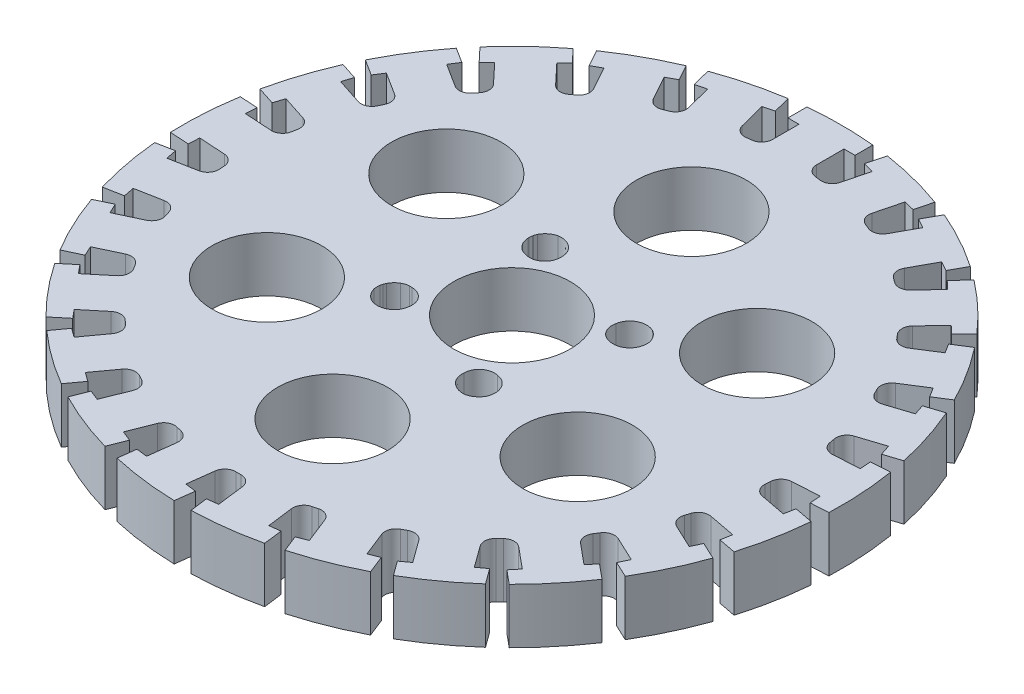
from build123d import *

# Parameters (mm, degrees)
BOSS_EXTRUDE2_DEPTH      = 6.35
FILLET2_R                = 1.27
FILLET3_R                = 1.27
CUT_EXTRUDE1_REACH       = 56.254
SKETCH2_R                = 2.413
SKETCH2_R_2              = 6.35
CUT_EXTRUDE4_START       = -6.35
CUT_EXTRUDE4_OUTLINE_R   = 6.75
CUT_EXTRUDE4_OUTLINE_R_2 = 2.413
CUT_EXTRUDE4_DEPTH       = 6.35


# Read off the part's stored shape, not the designer's step: Cut-Extrude4
with BuildPart() as part:
    # Sketch1 → Boss-Extrude2 (new body)
    with BuildSketch(Plane(origin=(0, 0, 0), x_dir=(1, 0, 0), z_dir=(0, 1, 0))):
        with BuildLine():
            Line((-2.54, 31.528459964), (-2.54, 35.718625011))
            Line((-2.54, 35.718625011), (-3.81, 35.718625011))
            Line((-3.81, 35.718625011), (-3.81, 37.909021354))
            ThreePointArc((-3.81, 37.909021354), (0, 38.1), (3.81, 37.909021354))
            Line((3.81, 37.909021354), (3.81, 35.847599361))
            Line((3.81, 35.847599361), (2.54, 35.847599361))
            Line((2.54, 35.847599361), (2.54, 31.528459964))
            ThreePointArc((2.54, 31.528459964), (3.96436643, 31.381191604), (5.380607922, 31.169607731))
            Line((5.380607922, 31.169607731), (6.422659594, 35.228131037))
            Line((6.422659594, 35.228131037), (5.19255898, 35.543967194))
            Line((5.19255898, 35.543967194), (5.737288399, 37.665548208))
            ThreePointArc((5.737288399, 37.665548208), (9.475084701, 36.903018439), (13.117892087, 35.770531268))
            Line((13.117892087, 35.770531268), (12.605237284, 33.773872638))
            Line((12.605237284, 33.773872638), (11.375136669, 34.089708794))
            Line((11.375136669, 34.089708794), (10.30101038, 29.906263104))
            ThreePointArc((10.30101038, 29.906263104), (11.644003568, 29.409395924), (12.963132459, 28.85225441))
            Line((12.963132459, 28.85225441), (14.981759865, 32.524124031))
            Line((14.981759865, 32.524124031), (13.868850382, 33.135951197))
            Line((13.868850382, 33.135951197), (14.924081868, 35.055410145))
            ThreePointArc((14.924081868, 35.055410145), (18.354814983, 33.38728451), (21.60153877, 31.384447148))
            Line((21.60153877, 31.384447148), (20.608441151, 29.578009285))
            Line((20.608441151, 29.578009285), (19.495531667, 30.189836451))
            Line((19.495531667, 30.189836451), (17.414770394, 26.404945745))
            ThreePointArc((17.414770394, 26.404945745), (18.592005138, 25.589699737), (19.731135709, 24.722007834))
            Line((19.731135709, 24.722007834), (22.599501065, 27.776506696))
            Line((22.599501065, 27.776506696), (21.673710908, 28.645881521))
            Line((21.673710908, 28.645881521), (23.173140386, 30.242611737))
            ThreePointArc((23.173140386, 30.242611737), (26.081244736, 27.773704705), (28.727881327, 25.02636279))
            Line((28.727881327, 25.02636279), (27.316740867, 23.523650829))
            Line((27.316740867, 23.523650829), (26.390950711, 24.393025653))
            Line((26.390950711, 24.393025653), (23.434296336, 21.244508535))
            ThreePointArc((23.434296336, 21.244508535), (24.371802648, 20.162108604), (25.259359136, 19.038386584))
            Line((25.259359136, 19.038386584), (28.797232498, 21.283589291))
            Line((28.797232498, 21.283589291), (28.116732468, 22.355885757))
            Line((28.116732468, 22.355885757), (29.966145269, 23.529558809))
            ThreePointArc((29.966145269, 23.529558809), (32.168893962, 20.415000889), (34.049145446, 17.095780017))
            Line((34.049145446, 17.095780017), (32.308629291, 15.991214877))
            Line((32.308629291, 15.991214877), (31.628129262, 17.063511342))
            Line((31.628129262, 17.063511342), (27.981359255, 14.749200722))
            ThreePointArc((27.981359255, 14.749200722), (28.620230165, 13.467658036), (29.200444132, 12.158513487))
            Line((29.200444132, 12.158513487), (33.185527904, 13.453345695))
            Line((33.185527904, 13.453345695), (32.793076321, 14.661187471))
            Line((32.793076321, 14.661187471), (34.876267036, 15.338057166))
            ThreePointArc((34.876267036, 15.338057166), (36.235253271, 11.773547486), (37.230976533, 8.091006511))
            Line((37.230976533, 8.091006511), (35.270447714, 7.453992083))
            Line((35.270447714, 7.453992083), (34.877996131, 8.661833859))
            Line((34.877996131, 8.661833859), (30.770250463, 7.327146384))
            ThreePointArc((30.770250463, 7.327146384), (31.070343363, 5.926984983), (31.30675783, 4.514676271))
            Line((31.30675783, 4.514676271), (35.488654544, 4.777778911))
            Line((35.488654544, 4.777778911), (35.408910584, 6.045272857))
            Line((35.408910584, 6.045272857), (37.59498468, 6.182808981))
            ThreePointArc((37.59498468, 6.182808981), (38.024818353, 2.392318794), (38.073448439, -1.42215469))
            Line((38.073448439, -1.42215469), (36.016094192, -1.551592448))
            Line((36.016094192, -1.551592448), (35.936350232, -0.284098502))
            Line((35.936350232, -0.284098502), (31.62573367, -0.555299509))
            ThreePointArc((31.62573367, -0.555299509), (31.568192619, -1.986102334), (31.445952797, -3.412834658))
            Line((31.445952797, -3.412834658), (35.5618985, -4.197993293))
            Line((35.5618985, -4.197993293), (35.79987277, -2.950488484))
            Line((35.79987277, -2.950488484), (37.951471172, -3.360927831))
            ThreePointArc((37.951471172, -3.360927831), (37.425144253, -7.139228086), (36.523625555, -10.845956681))
            Line((36.523625555, -10.845956681), (34.498717013, -10.459684718))
            Line((34.498717013, -10.459684718), (34.736691282, -9.21217991))
            Line((34.736691282, -9.21217991), (30.494055718, -8.402853892))
            ThreePointArc((30.494055718, -8.402853892), (30.082496232, -9.774395538), (29.609282898, -11.125904634))
            Line((29.609282898, -11.125904634), (33.400657587, -12.909990139))
            Line((33.400657587, -12.909990139), (33.941397287, -11.760859783))
            Line((33.941397287, -11.760859783), (35.923327154, -12.693485186))
            ThreePointArc((35.923327154, -12.693485186), (34.473910699, -16.222191009), (32.678888953, -19.588267326))
            Line((32.678888953, -19.588267326), (30.813658567, -18.71055653))
            Line((30.813658567, -18.71055653), (31.354398267, -17.561426173))
            Line((31.354398267, -17.561426173), (27.446324097, -15.722426061))
            ThreePointArc((27.446324097, -15.722426061), (26.706605972, -16.948527522), (25.91215286, -18.139893104))
            Line((25.91215286, -18.139893104), (29.140730518, -20.810804826))
            Line((29.140730518, -20.810804826), (29.950258985, -19.832253008))
            Line((29.950258985, -19.832253008), (31.637988375, -21.228464184))
            ThreePointArc((31.637988375, -21.228464184), (29.35655455, -24.285854009), (26.780817573, -27.099775094))
            Line((26.780817573, -27.099775094), (25.192464628, -25.785775262))
            Line((25.192464628, -25.785775262), (26.001993095, -24.807223444))
            Line((26.001993095, -24.807223444), (22.674038992, -22.054100377))
            ThreePointArc((22.674038992, -22.054100377), (21.652641438, -23.057721189), (20.58686696, -24.014085376))
            Line((20.58686696, -24.014085376), (23.049784179, -27.404000108))
            Line((23.049784179, -27.404000108), (24.077235762, -26.657512838))
            Line((24.077235762, -26.657512838), (25.364718429, -28.429580704))
            ThreePointArc((25.364718429, -28.429580704), (22.394618112, -30.823547486), (19.200008932, -32.908504327))
            Line((19.200008932, -32.908504327), (17.988335486, -31.240778902))
            Line((17.988335486, -31.240778902), (19.015787069, -30.494291631))
            Line((19.015787069, -30.494291631), (16.477060628, -27.000034458))
            ThreePointArc((16.477060628, -27.000034458), (15.23816181, -27.718113434), (13.968032495, -28.379384347))
            Line((13.968032495, -28.379384347), (15.510535129, -32.275301279))
            Line((15.510535129, -32.275301279), (16.691351266, -31.807783097))
            Line((16.691351266, -31.807783097), (17.49768994, -33.844362112))
            ThreePointArc((17.49768994, -33.844362112), (14.025545457, -35.424484112), (10.412793117, -36.649471203))
            Line((10.412793117, -36.649471203), (9.653933068, -34.732809507))
            Line((9.653933068, -34.732809507), (10.834749205, -34.265291325))
            Line((10.834749205, -34.265291325), (9.244767947, -30.249457074))
            ThreePointArc((9.244767947, -30.249457074), (7.866212434, -30.636874671), (6.471535178, -30.961502227))
            Line((6.471535178, -30.961502227), (6.996702112, -35.11862657))
            Line((6.996702112, -35.11862657), (8.256687783, -34.959453364))
            Line((8.256687783, -34.959453364), (8.53121724, -37.132577778))
            ThreePointArc((8.53121724, -37.132577778), (4.775196199, -37.79957012), (0.971303216, -38.087617017))
            Line((0.971303216, -38.087617017), (0.712938531, -36.042449953))
            Line((0.712938531, -36.042449953), (1.972924202, -35.883276746))
            Line((1.972924202, -35.883276746), (1.431592495, -31.598195053))
            ThreePointArc((1.431592495, -31.598195053), (0, -31.630608399), (-1.431592495, -31.598195053))
            Line((-1.431592495, -31.598195053), (-1.95675943, -35.755319397))
            Line((-1.95675943, -35.755319397), (-0.696773759, -35.914492604))
            Line((-0.696773759, -35.914492604), (-0.971303216, -38.087617017))
            ThreePointArc((-0.971303216, -38.087617017), (-4.775196199, -37.79957012), (-8.53121724, -37.132577778))
            Line((-8.53121724, -37.132577778), (-8.272852555, -35.087410713))
            Line((-8.272852555, -35.087410713), (-7.012866885, -35.246583919))
            Line((-7.012866885, -35.246583919), (-6.471535178, -30.961502227))
            ThreePointArc((-6.471535178, -30.961502227), (-7.866212434, -30.636874671), (-9.244767947, -30.249457074))
            Line((-9.244767947, -30.249457074), (-10.78727058, -34.145374007))
            Line((-10.78727058, -34.145374007), (-9.606454443, -34.612892189))
            Line((-9.606454443, -34.612892189), (-10.412793117, -36.649471203))
            ThreePointArc((-10.412793117, -36.649471203), (-14.025545457, -35.424484112), (-17.49768994, -33.844362112))
            Line((-17.49768994, -33.844362112), (-16.738829891, -31.927700416))
            Line((-16.738829891, -31.927700416), (-15.558013754, -32.395218597))
            Line((-15.558013754, -32.395218597), (-13.968032495, -28.379384347))
            ThreePointArc((-13.968032495, -28.379384347), (-15.23816181, -27.718113434), (-16.477060628, -27.000034458))
            Line((-16.477060628, -27.000034458), (-18.939977848, -30.38994919))
            Line((-18.939977848, -30.38994919), (-17.912526265, -31.13643646))
            Line((-17.912526265, -31.13643646), (-19.200008932, -32.908504327))
            ThreePointArc((-19.200008932, -32.908504327), (-22.394618112, -30.823547486), (-25.364718429, -28.429580704))
            Line((-25.364718429, -28.429580704), (-24.153044983, -26.761855279))
            Line((-24.153044983, -26.761855279), (-23.1255934, -27.50834255))
            Line((-23.1255934, -27.50834255), (-20.58686696, -24.014085376))
            ThreePointArc((-20.58686696, -24.014085376), (-21.652641438, -23.057721189), (-22.674038992, -22.054100377))
            Line((-22.674038992, -22.054100377), (-25.90261665, -24.725012099))
            Line((-25.90261665, -24.725012099), (-25.093088183, -25.703563918))
            Line((-25.093088183, -25.703563918), (-26.780817573, -27.099775094))
            ThreePointArc((-26.780817573, -27.099775094), (-29.35655455, -24.285854009), (-31.637988375, -21.228464184))
            Line((-31.637988375, -21.228464184), (-30.04963543, -19.914464353))
            Line((-30.04963543, -19.914464353), (-29.240106963, -20.893016171))
            Line((-29.240106963, -20.893016171), (-25.91215286, -18.139893104))
            ThreePointArc((-25.91215286, -18.139893104), (-26.706605972, -16.948527522), (-27.446324097, -15.722426061))
            Line((-27.446324097, -15.722426061), (-31.237698786, -17.506511566))
            Line((-31.237698786, -17.506511566), (-30.696959086, -18.655641923))
            Line((-30.696959086, -18.655641923), (-32.678888953, -19.588267326))
            ThreePointArc((-32.678888953, -19.588267326), (-34.473910699, -16.222191009), (-35.923327154, -12.693485186))
            Line((-35.923327154, -12.693485186), (-34.058096769, -11.81577439))
            Line((-34.058096769, -11.81577439), (-33.517357068, -12.964904747))
            Line((-33.517357068, -12.964904747), (-29.609282898, -11.125904634))
            ThreePointArc((-29.609282898, -11.125904634), (-30.082496232, -9.774395538), (-30.494055718, -8.402853892))
            Line((-30.494055718, -8.402853892), (-34.610001422, -9.188012527))
            Line((-34.610001422, -9.188012527), (-34.372027153, -10.435517335))
            Line((-34.372027153, -10.435517335), (-36.523625555, -10.845956681))
            ThreePointArc((-36.523625555, -10.845956681), (-37.425144253, -7.139228086), (-37.951471172, -3.360927831))
            Line((-37.951471172, -3.360927831), (-35.92656263, -2.974655868))
            Line((-35.92656263, -2.974655868), (-35.68858836, -4.222160676))
            Line((-35.68858836, -4.222160676), (-31.445952797, -3.412834658))
            ThreePointArc((-31.445952797, -3.412834658), (-31.568192619, -1.986102334), (-31.62573367, -0.555299509))
            Line((-31.62573367, -0.555299509), (-35.807630383, -0.292196869))
            Line((-35.807630383, -0.292196869), (-35.887374343, -1.559690814))
            Line((-35.887374343, -1.559690814), (-38.073448439, -1.42215469))
            ThreePointArc((-38.073448439, -1.42215469), (-38.024818353, 2.392318794), (-37.59498468, 6.182808981))
            Line((-37.59498468, 6.182808981), (-35.537630433, 6.053371223))
            Line((-35.537630433, 6.053371223), (-35.617374393, 4.785877278))
            Line((-35.617374393, 4.785877278), (-31.30675783, 4.514676271))
            ThreePointArc((-31.30675783, 4.514676271), (-31.070343363, 5.926984983), (-30.770250463, 7.327146384))
            Line((-30.770250463, 7.327146384), (-34.755334235, 8.621978593))
            Line((-34.755334235, 8.621978593), (-35.147785818, 7.414136817))
            Line((-35.147785818, 7.414136817), (-37.230976533, 8.091006511))
            ThreePointArc((-37.230976533, 8.091006511), (-36.235253271, 11.773547486), (-34.876267036, 15.338057166))
            Line((-34.876267036, 15.338057166), (-32.915738217, 14.701042737))
            Line((-32.915738217, 14.701042737), (-33.3081898, 13.493200961))
            Line((-33.3081898, 13.493200961), (-29.200444132, 12.158513487))
            ThreePointArc((-29.200444132, 12.158513487), (-28.620230165, 13.467658036), (-27.981359255, 14.749200722))
            Line((-27.981359255, 14.749200722), (-31.519232616, 16.99440343))
            Line((-31.519232616, 16.99440343), (-32.199732646, 15.922106964))
            Line((-32.199732646, 15.922106964), (-34.049145446, 17.095780017))
            ThreePointArc((-34.049145446, 17.095780017), (-32.168893962, 20.415000889), (-29.966145269, 23.529558809))
            Line((-29.966145269, 23.529558809), (-28.225629114, 22.424993669))
            Line((-28.225629114, 22.424993669), (-28.906129143, 21.352697204))
            Line((-28.906129143, 21.352697204), (-25.259359136, 19.038386584))
            ThreePointArc((-25.259359136, 19.038386584), (-24.371802648, 20.162108604), (-23.434296336, 21.244508535))
            Line((-23.434296336, 21.244508535), (-26.302661692, 24.299007398))
            Line((-26.302661692, 24.299007398), (-27.228451849, 23.429632574))
            Line((-27.228451849, 23.429632574), (-28.727881327, 25.02636279))
            ThreePointArc((-28.727881327, 25.02636279), (-26.081244736, 27.773704705), (-23.173140386, 30.242611737))
            Line((-23.173140386, 30.242611737), (-21.761999926, 28.739899776))
            Line((-21.761999926, 28.739899776), (-22.687790083, 27.870524951))
            Line((-22.687790083, 27.870524951), (-19.731135709, 24.722007834))
            ThreePointArc((-19.731135709, 24.722007834), (-18.592005138, 25.589699737), (-17.414770394, 26.404945745))
            Line((-17.414770394, 26.404945745), (-19.4333978, 30.076815367))
            Line((-19.4333978, 30.076815367), (-20.546307284, 29.4649882))
            Line((-20.546307284, 29.4649882), (-21.60153877, 31.384447148))
            ThreePointArc((-21.60153877, 31.384447148), (-18.354814983, 33.38728451), (-14.924081868, 35.055410145))
            Line((-14.924081868, 35.055410145), (-13.930984249, 33.248972282))
            Line((-13.930984249, 33.248972282), (-15.043893733, 32.637145116))
            Line((-15.043893733, 32.637145116), (-12.963132459, 28.85225441))
            ThreePointArc((-12.963132459, 28.85225441), (-11.644003568, 29.409395924), (-10.30101038, 29.906263104))
            Line((-10.30101038, 29.906263104), (-11.343062053, 33.964786411))
            Line((-11.343062053, 33.964786411), (-12.573162667, 33.648950254))
            Line((-12.573162667, 33.648950254), (-13.117892087, 35.770531268))
            ThreePointArc((-13.117892087, 35.770531268), (-9.475084701, 36.903018439), (-5.737288399, 37.665548208))
            Line((-5.737288399, 37.665548208), (-5.224633596, 35.668889578))
            Line((-5.224633596, 35.668889578), (-6.454734211, 35.353053421))
            Line((-6.454734211, 35.353053421), (-5.380607922, 31.169607731))
            ThreePointArc((-5.380607922, 31.169607731), (-3.96436643, 31.381191604), (-2.54, 31.528459964))
        make_face()
    extrude(amount=BOSS_EXTRUDE2_DEPTH)

    # Fillet2
    fillet2_edges = [part.edges().sort_by_distance(p)[0] for p in [
        (-2.54, 3.175, -31.528459964),
        (2.54, 3.175, -31.528459964),
        (5.380607922, 3.175, -31.169607731),
        (10.30101038, 3.175, -29.906263104),
        (12.963132459, 3.175, -28.85225441),
        (17.414770394, 3.175, -26.404945745),
        (19.731135709, 3.175, -24.722007834),
        (23.434296336, 3.175, -21.244508535),
        (25.259359136, 3.175, -19.038386584),
        (27.981359255, 3.175, -14.749200722),
        (29.200444132, 3.175, -12.158513487),
        (30.770250463, 3.175, -7.327146384),
        (31.30675783, 3.175, -4.514676271),
        (31.62573367, 3.175, 0.555299509),
        (31.445952797, 3.175, 3.412834658),
        (30.494055718, 3.175, 8.402853892),
        (29.609282898, 3.175, 11.125904634),
        (27.446324097, 3.175, 15.722426061),
        (25.91215286, 3.175, 18.139893104),
        (22.674038992, 3.175, 22.054100377),
        (20.58686696, 3.175, 24.014085376),
        (16.477060628, 3.175, 27.000034458),
        (13.968032495, 3.175, 28.379384347),
        (9.244767947, 3.175, 30.249457074),
        (6.471535178, 3.175, 30.961502227),
        (1.431592495, 3.175, 31.598195053),
        (-1.431592495, 3.175, 31.598195053),
        (-6.471535178, 3.175, 30.961502227),
        (-9.244767947, 3.175, 30.249457074),
        (-13.968032495, 3.175, 28.379384347),
        (-16.477060628, 3.175, 27.000034458),
        (-20.58686696, 3.175, 24.014085376),
        (-22.674038992, 3.175, 22.054100377),
        (-25.91215286, 3.175, 18.139893104),
        (-27.446324097, 3.175, 15.722426061),
        (-30.494055718, 3.175, 8.402853892),
        (-31.62573367, 3.175, 0.555299509),
        (-30.770250463, 3.175, -7.327146384),
        (-29.200444132, 3.175, -12.158513487),
        (-27.981359255, 3.175, -14.749200722),
        (-25.259359136, 3.175, -19.038386584),
        (-23.434296336, 3.175, -21.244508535),
        (-19.731135709, 3.175, -24.722007834),
        (-17.414770394, 3.175, -26.404945745),
        (-12.963132459, 3.175, -28.85225441),
        (-10.30101038, 3.175, -29.906263104),
        (-5.380607922, 3.175, -31.169607731),
    ]]
    fillet(fillet2_edges, radius=FILLET2_R)

    # Fillet3
    fillet3_edges = [part.edges().sort_by_distance(p)[0] for p in [
        (-29.609282898, 3.175, 11.125904634),
        (-31.445952797, 3.175, 3.412834658),
        (-31.30675783, 3.175, -4.514676271),
    ]]
    fillet(fillet3_edges, radius=FILLET3_R)

    # Sketch2 → Cut-Extrude1 (cut, up to next)
    with BuildSketch(Plane(origin=(0, 6.35, 0), x_dir=(1, 0, 0), z_dir=(0, 1, 0)), mode=Mode.PRIVATE) as cut_extrude1_sk1:
        with Locations(Location((0, 0, 0), (0, 0, 270))):
            Circle(SKETCH2_R)
    cut_extrude1_tool1 = extrude(cut_extrude1_sk1.sketch, amount=-CUT_EXTRUDE1_REACH, mode=Mode.PRIVATE) & part.part
    # Sketch2 → Cut-Extrude1 (cut, up to next)
    with BuildSketch(Plane(origin=(0, 6.35, 0), x_dir=(1, 0, 0), z_dir=(0, 1, 0)), mode=Mode.PRIVATE) as cut_extrude1_sk2:
        with Locations(Location((0, 20.747039709, 0), (0, 0, 270))):
            Circle(SKETCH2_R_2)
    cut_extrude1_tool2 = extrude(cut_extrude1_sk2.sketch, amount=-CUT_EXTRUDE1_REACH, mode=Mode.PRIVATE) & part.part
    # Sketch2 → Cut-Extrude1 (cut, up to next)
    with BuildSketch(Plane(origin=(0, 6.35, 0), x_dir=(1, 0, 0), z_dir=(0, 1, 0)), mode=Mode.PRIVATE) as cut_extrude1_sk3:
        with Locations(Location((17.967463441, 10.373519854, 0), (0, 0, 270))):
            Circle(SKETCH2_R_2)
    cut_extrude1_tool3 = extrude(cut_extrude1_sk3.sketch, amount=-CUT_EXTRUDE1_REACH, mode=Mode.PRIVATE) & part.part
    # Sketch2 → Cut-Extrude1 (cut, up to next)
    with BuildSketch(Plane(origin=(0, 6.35, 0), x_dir=(1, 0, 0), z_dir=(0, 1, 0)), mode=Mode.PRIVATE) as cut_extrude1_sk4:
        with Locations(Location((17.967463441, -10.373519854, 0), (0, 0, 270))):
            Circle(SKETCH2_R_2)
    cut_extrude1_tool4 = extrude(cut_extrude1_sk4.sketch, amount=-CUT_EXTRUDE1_REACH, mode=Mode.PRIVATE) & part.part
    # Sketch2 → Cut-Extrude1 (cut, up to next)
    with BuildSketch(Plane(origin=(0, 6.35, 0), x_dir=(1, 0, 0), z_dir=(0, 1, 0)), mode=Mode.PRIVATE) as cut_extrude1_sk5:
        with Locations(Location((0, -20.747039709, 0), (0, 0, 270))):
            Circle(SKETCH2_R_2)
    cut_extrude1_tool5 = extrude(cut_extrude1_sk5.sketch, amount=-CUT_EXTRUDE1_REACH, mode=Mode.PRIVATE) & part.part
    # Sketch2 → Cut-Extrude1 (cut, up to next)
    with BuildSketch(Plane(origin=(0, 6.35, 0), x_dir=(1, 0, 0), z_dir=(0, 1, 0)), mode=Mode.PRIVATE) as cut_extrude1_sk6:
        with Locations(Location((-17.967463441, -10.373519854, 0), (0, 0, 270))):
            Circle(SKETCH2_R_2)
    cut_extrude1_tool6 = extrude(cut_extrude1_sk6.sketch, amount=-CUT_EXTRUDE1_REACH, mode=Mode.PRIVATE) & part.part
    # Sketch2 → Cut-Extrude1 (cut, up to next)
    with BuildSketch(Plane(origin=(0, 6.35, 0), x_dir=(1, 0, 0), z_dir=(0, 1, 0)), mode=Mode.PRIVATE) as cut_extrude1_sk7:
        with Locations(Location((-17.967463441, 10.373519854, 0), (0, 0, 270))):
            Circle(SKETCH2_R_2)
    cut_extrude1_tool7 = extrude(cut_extrude1_sk7.sketch, amount=-CUT_EXTRUDE1_REACH, mode=Mode.PRIVATE) & part.part
    add(cut_extrude1_tool1.solids().sort_by_distance((0, 6.35, 0))[0], mode=Mode.SUBTRACT)
    add(cut_extrude1_tool2.solids().sort_by_distance((0, 6.35, -20.74704))[0], mode=Mode.SUBTRACT)
    add(cut_extrude1_tool3.solids().sort_by_distance((17.967463, 6.35, -10.37352))[0], mode=Mode.SUBTRACT)
    add(cut_extrude1_tool4.solids().sort_by_distance((17.967463, 6.35, 10.37352))[0], mode=Mode.SUBTRACT)
    add(cut_extrude1_tool5.solids().sort_by_distance((0, 6.35, 20.74704))[0], mode=Mode.SUBTRACT)
    add(cut_extrude1_tool6.solids().sort_by_distance((-17.967463, 6.35, 10.37352))[0], mode=Mode.SUBTRACT)
    add(cut_extrude1_tool7.solids().sort_by_distance((-17.967463, 6.35, -10.37352))[0], mode=Mode.SUBTRACT)

    # Cut-Extrude4 outline → Cut-Extrude4 (cut)
    # profile 1 of 5: a face of its own
    with BuildSketch(Plane(origin=(0, 6.35, 0), x_dir=(1, 0, 0), z_dir=(0, 1, 0)).offset(CUT_EXTRUDE4_START)):
        with BuildLine():
            ThreePointArc((-10.62600838, -5.310281627), (-10.248304054, -6.070227928), (-9.606231203, -6.625134581))
            add(Edge.make_bspline(
                [(-9.606231203, -6.625134581), (-9.46655921, -6.684709974), (-9.32392467, -6.73217541), (-9.030651615, -6.794388577), (-8.877874218, -6.809243899), (-8.576646272, -6.803875532), (-8.4282227, -6.784317099), (-8.135771733, -6.711333312), (-7.992122613, -6.657387497), (-7.724714269, -6.520442305), (-7.597564346, -6.435850969), (-7.366578931, -6.240485889), (-7.263201766, -6.131634161), (-7.084827599, -5.887767339), (-7.010920186, -5.753152371), (-6.901199751, -5.473578389), (-6.863911931, -5.325167908), (-6.846476763, -5.17348826)],
                knots=[0, 0, 0, 0, 0.125, 0.125, 0.25, 0.25, 0.375, 0.375, 0.5, 0.5, 0.625, 0.625, 0.75, 0.75, 0.875, 0.875, 1, 1, 1, 1], degree=3))
            ThreePointArc((-6.846476763, -5.17348826), (-7.166405914, -3.671884676), (-8.546129376, -2.998437457))
            add(Edge.make_bspline(
                [(-8.546129376, -2.998437457), (-8.648107427, -2.985263455), (-8.750581128, -2.981011082), (-8.852495042, -2.985549928)],
                knots=[0.008884909, 0.008884909, 0.008884909, 0.008884909, 0.091855238, 0.091855238, 0.091855238, 0.091855238], degree=3))
            add(Edge.make_bspline(
                [(-8.852495042, -2.985549928), (-8.900088348, -2.987687901), (-8.94760407, -2.991760621), (-9.143920135, -3.01650163), (-9.291903615, -3.054643871), (-9.517537575, -3.144466879), (-9.602127817, -3.186378735), (-9.683059633, -3.234405276)],
                knots=[0.085168953, 0.085168953, 0.085168953, 0.085168953, 0.125, 0.125, 0.25, 0.25, 0.328024896, 0.328024896, 0.328024896, 0.328024896], degree=3))
            add(Edge.make_bspline(
                [(-9.683059633, -3.234405276), (-9.73186941, -3.263393287), (-9.779277878, -3.294559195), (-9.944790929, -3.414075653), (-10.0562227, -3.515101288), (-10.253904734, -3.739453854), (-10.338954228, -3.860865195), (-10.421167328, -4.011469377), (-10.431372741, -4.030926284), (-10.441254977, -4.050546081)],
                knots=[0.328777005, 0.328777005, 0.328777005, 0.328777005, 0.375, 0.375, 0.5, 0.5, 0.625, 0.625, 0.643348749, 0.643348749, 0.643348749, 0.643348749], degree=3))
            add(Edge.make_bspline(
                [(-10.441254977, -4.050546081), (-10.493271806, -4.153906193), (-10.53672704, -4.262658038), (-10.570198237, -4.373227762)],
                knots=[0.641274467, 0.641274467, 0.641274467, 0.641274467, 0.737556322, 0.737556322, 0.737556322, 0.737556322], degree=3))
            add(Edge.make_bspline(
                [(-10.570198237, -4.373227762), (-10.573495167, -4.384104203), (-10.576690099, -4.395003101), (-10.600275217, -4.478089417), (-10.616732146, -4.551306748), (-10.629058695, -4.625494782)],
                knots=[0.740440221, 0.740440221, 0.740440221, 0.740440221, 0.75, 0.75, 0.813197252, 0.813197252, 0.813197252, 0.813197252], degree=3))
            add(Edge.make_bspline(
                [(-10.629058695, -4.625494782), (-10.641873922, -4.702566222), (-10.650214277, -4.780614567), (-10.661185511, -5.010742696), (-10.649620707, -5.160863645), (-10.62600838, -5.310281627)],
                knots=[0.809769201, 0.809769201, 0.809769201, 0.809769201, 0.875, 0.875, 1, 1, 1, 1], degree=3))
        make_face()
    # profile 2 of 5: a face of its own
    with BuildSketch(Plane(origin=(0, 6.35, 0), x_dir=(1, 0, 0), z_dir=(0, 1, 0)).offset(CUT_EXTRUDE4_START)):
        with BuildLine():
            ThreePointArc((5.30449591, -10.627556477), (6.069395261, -10.248949529), (6.627041216, -9.602849516))
            add(Edge.make_bspline(
                [(6.627041216, -9.602849516), (6.655320337, -9.533018491), (6.683488095, -9.463162009), (6.729078077, -9.320992712), (6.748153446, -9.249057792), (6.79420988, -9.030699742), (6.809281082, -8.879609432), (6.803925395, -8.578757146), (6.784101555, -8.431213037), (6.712415823, -8.141510024), (6.659480403, -7.997863063), (6.45677179, -7.597262964), (6.258631026, -7.35999293), (5.89912979, -7.091382625), (5.765235035, -7.015524584), (5.485712856, -6.91127229), (5.339128939, -6.880104039), (5.191828177, -6.851137744)],
                knots=[0, 0, 0, 0, 0.0625, 0.0625, 0.125, 0.125, 0.25, 0.25, 0.375, 0.375, 0.5, 0.5, 0.75, 0.75, 0.875, 0.875, 1, 1, 1, 1], degree=3))
            ThreePointArc((5.191828177, -6.851137744), (3.678400928, -7.161338583), (2.998437456, -8.548543066))
            add(Edge.make_bspline(
                [(2.998437456, -8.548543066), (2.979734322, -8.698630145), (2.978923452, -8.847957413), (3.016977944, -9.144927067), (3.054779792, -9.292699391), (3.16542026, -9.56966567), (3.239486153, -9.702596244), (3.414654846, -9.946012582), (3.515256147, -10.056655841), (3.742222567, -10.256042131), (3.864997476, -10.341567289), (4.127438471, -10.484106039), (4.268837333, -10.541448282), (4.556345539, -10.621887883), (4.70375488, -10.645368819), (4.929987654, -10.657149268), (5.005275537, -10.657107465), (5.155167041, -10.647144701), (5.229822335, -10.637194213), (5.30449591, -10.627556477)],
                knots=[0, 0, 0, 0, 0.125, 0.125, 0.25, 0.25, 0.375, 0.375, 0.5, 0.5, 0.625, 0.625, 0.75, 0.75, 0.875, 0.875, 0.9375, 0.9375, 1, 1, 1, 1], degree=3))
        make_face()
    # profile 3 of 5: a face of its own
    with BuildSketch(Plane(origin=(0, 6.35, 0), x_dir=(1, 0, 0), z_dir=(0, 1, 0)).offset(CUT_EXTRUDE4_START)):
        with BuildLine():
            ThreePointArc((6.846476763, 5.17348826), (7.166405826, 3.671884789), (8.546129089, 2.998437457))
            add(Edge.make_bspline(
                [(8.546129089, 2.998437457), (8.696537569, 2.978984852), (8.846166665, 2.978976828), (9.143920135, 3.01650163), (9.291903615, 3.054643871), (9.569743876, 3.165249775), (9.703213663, 3.23952432), (9.946630708, 3.41551416), (10.057735775, 3.516382717), (10.25754596, 3.7440335), (10.34288545, 3.866936631), (10.48538921, 4.130302573), (10.542598981, 4.272099964), (10.622746123, 4.560263946), (10.646767191, 4.708309901), (10.661185511, 5.010742696), (10.649620707, 5.160863645), (10.62600838, 5.310281627)],
                knots=[0, 0, 0, 0, 0.125, 0.125, 0.25, 0.25, 0.375, 0.375, 0.5, 0.5, 0.625, 0.625, 0.75, 0.75, 0.875, 0.875, 1, 1, 1, 1], degree=3))
            ThreePointArc((10.62600838, 5.310281627), (10.248304054, 6.070227928), (9.606231203, 6.625134581))
            add(Edge.make_bspline(
                [(9.606231203, 6.625134581), (9.46655921, 6.684709974), (9.32392467, 6.73217541), (9.030651615, 6.794388577), (8.877874218, 6.809243899), (8.576646272, 6.803875532), (8.4282227, 6.784317099), (8.135771733, 6.711333312), (7.992122613, 6.657387497), (7.724714269, 6.520442305), (7.597564346, 6.435850969), (7.366578931, 6.240485889), (7.263201766, 6.131634161), (7.084827599, 5.887767339), (7.010920186, 5.753152371), (6.901199751, 5.473578389), (6.863911931, 5.325167908), (6.846476763, 5.17348826)],
                knots=[0, 0, 0, 0, 0.125, 0.125, 0.25, 0.25, 0.375, 0.375, 0.5, 0.5, 0.625, 0.625, 0.75, 0.75, 0.875, 0.875, 1, 1, 1, 1], degree=3))
        make_face()
    # profile 4 of 5: a face of its own
    with BuildSketch(Plane(origin=(0, 6.35, 0), x_dir=(1, 0, 0), z_dir=(0, 1, 0)).offset(CUT_EXTRUDE4_START)):
        with BuildLine():
            ThreePointArc((-5.191828177, 6.851137744), (-3.678400928, 7.161338583), (-2.998437456, 8.548543066))
            add(Edge.make_bspline(
                [(-2.998437456, 8.548543066), (-2.979734322, 8.698630145), (-2.978923452, 8.847957413), (-3.016977944, 9.144927067), (-3.054779792, 9.292699391), (-3.16542026, 9.56966567), (-3.239486153, 9.702596244), (-3.414654846, 9.946012582), (-3.515256147, 10.056655841), (-3.742222567, 10.256042131), (-3.864997476, 10.341567289), (-4.127438471, 10.484106039), (-4.268837333, 10.541448282), (-4.556345539, 10.621887883), (-4.70375488, 10.645368819), (-4.929987654, 10.657149268), (-5.005275537, 10.657107465), (-5.155167041, 10.647144701), (-5.229822335, 10.637194213), (-5.30449591, 10.627556477)],
                knots=[0, 0, 0, 0, 0.125, 0.125, 0.25, 0.25, 0.375, 0.375, 0.5, 0.5, 0.625, 0.625, 0.75, 0.75, 0.875, 0.875, 0.9375, 0.9375, 1, 1, 1, 1], degree=3))
            ThreePointArc((-5.30449591, 10.627556477), (-6.069395261, 10.248949529), (-6.627041215, 9.602849516))
            add(Edge.make_bspline(
                [(-6.627041215, 9.602849516), (-6.674348706, 9.486030805), (-6.693711339, 9.429910126), (-6.725789091, 9.336935928), (-6.749862323, 9.236696471)],
                knots=[0, 0, 0, 0.5, 0.5, 1, 1, 1], degree=2))
            add(Edge.make_bspline(
                [(-6.749862323, 9.236696471), (-6.76440643, 9.176135707), (-6.77490198, 9.117989086)],
                knots=[0, 0, 0, 1, 1, 1], degree=2))
            add(Edge.make_bspline(
                [(-6.77490198, 9.117989086), (-6.803484041, 8.959641004), (-6.806547655, 8.801175965)],
                knots=[0, 0, 0, 1, 1, 1], degree=2))
            Line((-6.806547655, 8.801175965), (-6.806826066, 8.781764685))
            Line((-6.806826066, 8.781764685), (-6.806908345, 8.760673372))
            Line((-6.806908345, 8.760673372), (-6.805257437, 8.683313551))
            add(Edge.make_bspline(
                [(-6.805257437, 8.683313551), (-6.795516506, 8.445896233), (-6.729592773, 8.215625623), (-6.663465856, 7.984645295), (-6.5454225, 7.777945582)],
                knots=[0, 0, 0, 0.5, 0.5, 1, 1, 1], degree=2))
            Line((-6.5454225, 7.777945582), (-6.521129907, 7.736595101))
            Line((-6.521129907, 7.736595101), (-6.483300425, 7.676464403))
            Line((-6.483300425, 7.676464403), (-6.456019767, 7.635904904))
            add(Edge.make_bspline(
                [(-6.456019767, 7.635904904), (-6.35199434, 7.485321261), (-6.222122422, 7.356287651)],
                knots=[0, 0, 0, 1, 1, 1], degree=2))
            Line((-6.222122422, 7.356287651), (-6.208573748, 7.342957825))
            add(Edge.make_bspline(
                [(-6.208573748, 7.342957825), (-6.124064582, 7.260626441), (-6.030452377, 7.189571793)],
                knots=[0, 0, 0, 1, 1, 1], degree=2))
            add(Edge.make_bspline(
                [(-6.030452377, 7.189571793), (-5.871374555, 7.068826653), (-5.703207657, 6.995063639)],
                knots=[0, 0, 0, 1, 1, 1], degree=2))
            add(Edge.make_bspline(
                [(-5.703207657, 6.995063639), (-5.656236408, 6.974460649), (-5.609249279, 6.957452841)],
                knots=[0, 0, 0, 1, 1, 1], degree=2))
            add(Edge.make_bspline(
                [(-5.609249279, 6.957452841), (-5.510058173, 6.921548895), (-5.389515809, 6.892758755), (-5.324424419, 6.877212435), (-5.191828177, 6.851137744)],
                knots=[0, 0, 0, 0.5, 0.5, 1, 1, 1], degree=2))
        make_face()
    # profile 5 of 5: a face of its own
    with BuildSketch(Plane(origin=(0, 6.35, 0), x_dir=(1, 0, 0), z_dir=(0, 1, 0)).offset(CUT_EXTRUDE4_START)):
        Circle(CUT_EXTRUDE4_OUTLINE_R)
        Circle(CUT_EXTRUDE4_OUTLINE_R_2, mode=Mode.SUBTRACT)
    extrude(amount=CUT_EXTRUDE4_DEPTH, mode=Mode.SUBTRACT)


solid = part.part
